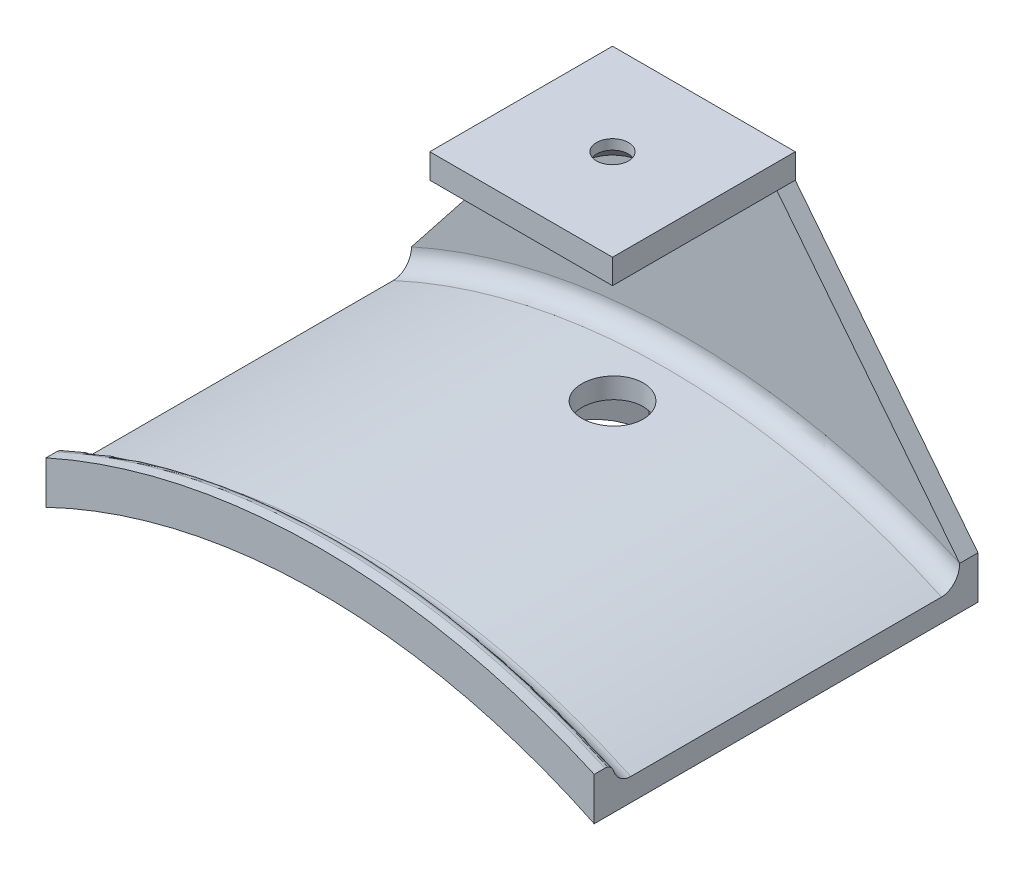
from build123d import *

# Parameters (mm, degrees)
CROQUIS1_W              = 60
CROQUIS1_H              = 30
SALIENTE_EXTRUIR1_DEPTH = 2
SALIENTE_EXTRUIR2_DEPTH = 38
SALIENTE_EXTRUIR4_DEPTH = 2
REDONDEO1_R             = 2
REDONDEO2_R             = 1
CORTAR_EXTRUIR2_DEPTH   = 2
CROQUIS7_W              = 20
CROQUIS7_H              = 20
SALIENTE_EXTRUIR5_DEPTH = 2.7
CROQUIS8_R              = 1.75
CORTAR_EXTRUIR3_DEPTH   = 2.7
CROQUIS11_R             = 3.36
CORTAR_EXTRUIR4_DEPTH   = 50
SALIENTE_EXTRUIR3_DEPTH = 15
CORTAR_EXTRUIR1_START   = -12.5
CORTAR_EXTRUIR1_DEPTH   = 12.5


with BuildPart() as part:
    # Croquis1 → Saliente-Extruir1 (new body)
    with BuildSketch(Plane.XY):
        with Locations((2.747988453, -8.28358209)):
            Rectangle(CROQUIS1_W, CROQUIS1_H)
    extrude(amount=SALIENTE_EXTRUIR1_DEPTH)

    # Croquis2 → Saliente-Extruir2 (add)
    with BuildSketch(Plane.XY.offset(2)):
        with BuildLine():
            Line((-27.252011547, -23.28358209), (-27.252011547, -20.794473938))
            ThreePointArc((-27.252011547, -20.794473938), (2.747988453, -14.174360447), (32.747988453, -20.794473938))
            Line((32.747988453, -20.794473938), (32.747988453, -23.28358209))
            ThreePointArc((32.747988453, -23.28358209), (2.747988453, -16.424360447), (-27.252011547, -23.28358209))
        make_face()
    extrude(amount=SALIENTE_EXTRUIR2_DEPTH)

    # Croquis5 → Saliente-Extruir4 (add)
    with BuildSketch(Plane.XY.offset(40)):
        with BuildLine():
            Line((32.747988453, -23.28358209), (32.747988453, -18.596159377))
            ThreePointArc((32.747988453, -18.596159377), (2.747988453, -12.174360447), (-27.252011547, -18.596159377))
            Line((-27.252011547, -18.596159377), (-27.252011547, -23.28358209))
            ThreePointArc((-27.252011547, -23.28358209), (2.747988453, -16.424360447), (32.747988453, -23.28358209))
        make_face()
    extrude(amount=SALIENTE_EXTRUIR4_DEPTH)

    # Redondeo1
    redondeo1_edges = [part.edges().sort_by_distance(p)[0] for p in [
        (2.747988453, -14.174360447, 2),
        (2.747988453, -14.174360447, 40),
    ]]
    fillet(redondeo1_edges, radius=REDONDEO1_R - 0.0001)  # a hair under: the kernel refuses the full size

    # Redondeo2
    redondeo2_edges = [part.edges().sort_by_distance(p)[0] for p in [
        (2.747988453, -12.174360447, 40),
    ]]
    fillet(redondeo2_edges, radius=REDONDEO2_R)

    # Croquis6 → Cortar-Extruir2 (cut)
    with BuildSketch(Plane.XY.offset(2)):
        Polygon((-27.252011547, -18.596159377), (-7.252011547, 6.71641791), (-27.252011547, 6.71641791), align=None)
        Polygon((12.747988453, 6.71641791), (32.747988453, 6.71641791), (32.747988453, -18.596159377), align=None)
    extrude(amount=-CORTAR_EXTRUIR2_DEPTH, mode=Mode.SUBTRACT)

    # Croquis7 → Saliente-Extruir5 (add)
    with BuildSketch(Plane(origin=(0, 6.71641791, 0), x_dir=(1, 0, 0), z_dir=(0, 1, 0))):
        with Locations((2.747988453, -10)):
            Rectangle(CROQUIS7_W, CROQUIS7_H)
    extrude(amount=SALIENTE_EXTRUIR5_DEPTH)

    # Croquis8 → Cortar-Extruir3 (cut)
    with BuildSketch(Plane(origin=(0, 9.41641791, 0), x_dir=(1, 0, 0), z_dir=(0, 1, 0))):
        with Locations(Location((2.747988453, -10, 0), (0, 0, 270))):
            Circle(CROQUIS8_R)
    extrude(amount=-CORTAR_EXTRUIR3_DEPTH, mode=Mode.SUBTRACT)

    # Croquis10 → Refrentado para tornillo tapón con cabeza plana de clavija de M31 (revolve, cut)
    with BuildSketch(Plane(origin=(2.747988453, 6.71641791, 10), x_dir=(0, 0, -1), z_dir=(1, 0, 0))):
        Polygon((0, 0), (0, 2.7), (1.7, 2.7), (1.7, 1.66), (3.36, 0), align=None)
    revolve(axis=Axis((2.747988453, 0.36641791, 10), (0, 1, 0)), mode=Mode.SUBTRACT)

    # Croquis11 → Cortar-Extruir4 (cut)
    with BuildSketch(Plane.XZ.offset(-6.71641791)):
        with Locations(Location((2.747988453, 10, 0), (0, 0, 90))):
            Circle(CROQUIS11_R)
    extrude(amount=CORTAR_EXTRUIR4_DEPTH, mode=Mode.SUBTRACT)

    # Croquis3 → Saliente-Extruir3 (add)
    with BuildSketch(Plane.XY.offset(2)):
        with BuildLine():
            Line((-1.252011547, -23.28358209), (-1.252011547, -16.540341587))
            ThreePointArc((-1.252011547, -16.540341587), (-2.377695965, -16.614909121), (-3.502011547, -16.70786179))
            Line((-3.502011547, -16.70786179), (-3.502011547, -23.28358209))
            Line((-3.502011547, -23.28358209), (-1.252011547, -23.28358209))
        make_face()
        with BuildLine():
            Line((8.997988453, -23.28358209), (8.997988453, -16.70786179))
            ThreePointArc((8.997988453, -16.70786179), (7.873672871, -16.614909121), (6.747988453, -16.540341587))
            Line((6.747988453, -16.540341587), (6.747988453, -23.28358209))
            Line((6.747988453, -23.28358209), (8.997988453, -23.28358209))
        make_face()
    extrude(amount=SALIENTE_EXTRUIR3_DEPTH)

    # Croquis4 → Cortar-Extruir1 (cut)
    with BuildSketch(Plane.ZY.offset(3.502011547).offset(CORTAR_EXTRUIR1_START)):
        with BuildLine():
            Line((17, -16.70786179), (17, -23.28358209))
            Line((17, -23.28358209), (2, -23.28358209))
            ThreePointArc((2, -23.28358209), (8.868759287, -18.555786805), (17, -16.70786179))
        make_face()
    extrude(amount=CORTAR_EXTRUIR1_DEPTH, mode=Mode.SUBTRACT)


solid = part.part
